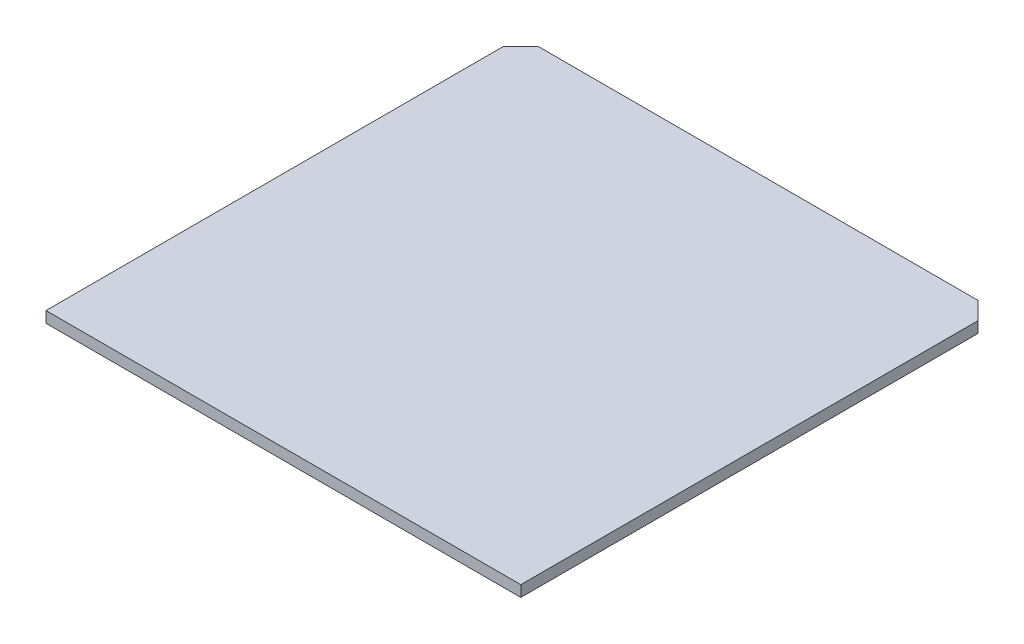
from build123d import *

# Parameters (mm, degrees)
SKETCH1_W           = 68.58
SKETCH1_H           = 68.58
BOSS_EXTRUDE1_DEPTH = 1.6
CHAMFER1_SIZE       = 2.54


with BuildPart() as part:
    # Sketch1 → Boss-Extrude1 (new body)
    with BuildSketch(Plane(origin=(0, 0, 0), x_dir=(1, 0, 0), z_dir=(0, 1, 0))):
        Rectangle(SKETCH1_W, SKETCH1_H)
    extrude(amount=BOSS_EXTRUDE1_DEPTH)

    # Chamfer1
    chamfer1_edges = [part.edges().sort_by_distance(p)[0] for p in [
        (34.29, 0.8, -34.29),
        (-34.29, 0.8, -34.29),
    ]]
    chamfer(chamfer1_edges, length=CHAMFER1_SIZE)


solid = part.part
